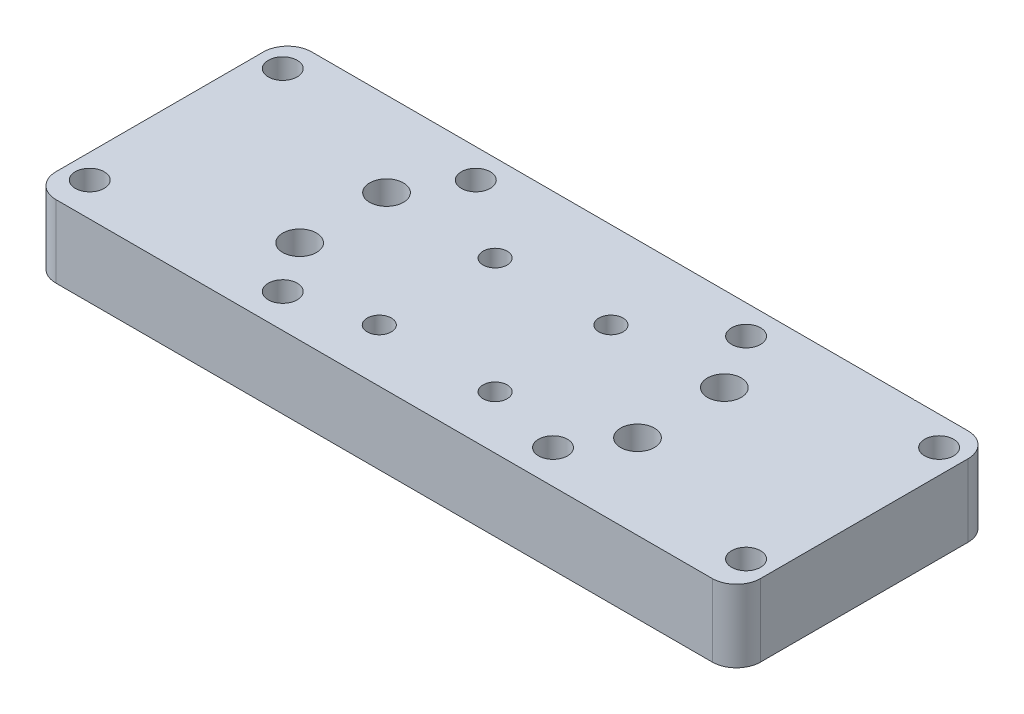
from build123d import *
from build123d.topology import SkipClean

# Parameters (mm, degrees)
SKETCH1_W            = 130
SKETCH1_H            = 100
SKETCH1_R            = 3
BOSS_EXTRUDE1_DEPTH  = 10
SKETCH2_W            = 130
SKETCH2_H            = 8.023003322
BOSS_EXTRUDE2_DEPTH  = 75
FILLET1_R            = 0.1
SKETCH3_W            = 130
SKETCH3_H            = 8.023003322
CUT_EXTRUDE1_DEPTH   = 75
SKETCH4_W            = 130
SKETCH4_H            = 10
CUT_EXTRUDE2_DEPTH   = 37
SKETCH5_W            = 130
SKETCH5_H            = 10
BOSS_EXTRUDE4_DEPTH  = 75
FILLET2_R            = 5
SKETCH6_R            = 10
SKETCH6_R_2          = 7.5
SKETCH6_R_3          = 3.5
SKETCH6_R_4          = 2.5
CUT_EXTRUDE3_DEPTH   = 10
SKETCH7_R            = 19.1
CUT_EXTRUDE4_DEPTH   = 10
SKETCH8_R            = 3.5
BOSS_EXTRUDE5_DEPTH  = 10
SKETCH9_W            = 130
SKETCH9_H            = 10
CUT_EXTRUDE5_DEPTH   = 168.612648687
SKETCH10_W           = 53
SKETCH10_H           = 10
BOSS_EXTRUDE6_DEPTH  = 30
SKETCH11_R           = 3
CUT_EXTRUDE6_DEPTH   = 30
BOSS_EXTRUDE7_START  = -10
SKETCH12_R           = 3
BOSS_EXTRUDE7_DEPTH  = 10
SKETCH14_W           = 53
SKETCH14_H           = 10
CUT_EXTRUDE7_DEPTH   = 14
SKETCH15_W           = 53
SKETCH15_H           = 10
CUT_EXTRUDE9_DEPTH   = 1.5
SKETCH16_W           = 53
SKETCH16_H           = 10
BOSS_EXTRUDE8_DEPTH  = 1.5
FILLET5_R            = 5
SKETCH17_R           = 2.5
CUT_EXTRUDE11_DEPTH  = 10
CUT_EXTRUDE12_DEPTH  = 10
BOSS_EXTRUDE9_DEPTH  = 10
SKETCH20_R           = 3.5
CUT_EXTRUDE13_DEPTH  = 160.32670837
BOSS_EXTRUDE10_START = 5
SKETCH21_R           = 3
SKETCH21_R_2         = 2.5
SKETCH21_R_3         = 3.5
BOSS_EXTRUDE10_DEPTH = 5


with BuildPart() as part:
    # Sketch1 → Boss-Extrude1 (new body)
    with BuildSketch(Plane(origin=(0, 0, 0), x_dir=(1, 0, 0), z_dir=(0, 1, 0))):
        with Locations((65, 13)):
            Rectangle(SKETCH1_W, SKETCH1_H)
        with Locations((5, 17)):
            Circle(SKETCH1_R, mode=Mode.SUBTRACT)
        with Locations((45, 17)):
            Circle(SKETCH1_R, mode=Mode.SUBTRACT)
        with Locations((5, 57)):
            Circle(SKETCH1_R, mode=Mode.SUBTRACT)
        with Locations((45, 57)):
            Circle(SKETCH1_R, mode=Mode.SUBTRACT)
        with Locations((85, 17)):
            Circle(SKETCH1_R, mode=Mode.SUBTRACT)
        with Locations((125, 17)):
            Circle(SKETCH1_R, mode=Mode.SUBTRACT)
        with Locations((85, 57)):
            Circle(SKETCH1_R, mode=Mode.SUBTRACT)
        with Locations((125, 57)):
            Circle(SKETCH1_R, mode=Mode.SUBTRACT)
    extrude(amount=BOSS_EXTRUDE1_DEPTH)

    # Sketch2 → Boss-Extrude2 (add)
    with BuildSketch(Plane(origin=(0, 10, 0), x_dir=(1, 0, 0), z_dir=(0, 1, 0))):
        with Locations((65, -32.988498339)):
            Rectangle(SKETCH2_W, SKETCH2_H)
    extrude(amount=BOSS_EXTRUDE2_DEPTH)

    # Fillet1
    fillet1_edges = [part.edges().sort_by_distance(p)[0] for p in [
        (0, 85, 32.988498339),
        (130, 85, 32.988498339),
        (130, 5, -63),
        (0, 5, -63),
    ]]
    fillet(fillet1_edges, radius=FILLET1_R)

    # Sketch3 → Cut-Extrude1 (cut)
    with BuildSketch(Plane(origin=(0, 85, 0), x_dir=(1, 0, 0), z_dir=(0, 1, 0))):
        with Locations((65, -32.988498339)):
            Rectangle(SKETCH3_W, SKETCH3_H)
    extrude(amount=-CUT_EXTRUDE1_DEPTH, mode=Mode.SUBTRACT)

    # Sketch4 → Cut-Extrude2 (cut)
    with BuildSketch(Plane.XY.offset(37)):
        with Locations((65, 5)):
            Rectangle(SKETCH4_W, SKETCH4_H)
    extrude(amount=-CUT_EXTRUDE2_DEPTH, mode=Mode.SUBTRACT)

    # Sketch5 → Boss-Extrude4 (add)
    with BuildSketch(Plane(origin=(0, 10, 0), x_dir=(1, 0, 0), z_dir=(0, 1, 0))):
        with Locations((65, 5)):
            Rectangle(SKETCH5_W, SKETCH5_H)
    extrude(amount=BOSS_EXTRUDE4_DEPTH)

    # Fillet2
    fillet2_edges = [part.edges().sort_by_distance(p)[0] for p in [
        (130, 85, -5),
        (0, 85, -5),
    ]]
    fillet(fillet2_edges, radius=FILLET2_R)

    # Sketch6 → Cut-Extrude3 (cut)
    with BuildSketch(Plane(origin=(0, 0, -10), x_dir=(-1, 0, 0), z_dir=(0, 0, -1))):
        with Locations((-113, 47.5)):
            Circle(SKETCH6_R)
        with Locations((-65, 47.5)):
            Circle(SKETCH6_R_2)
        with Locations((-17, 47.5)):
            Circle(SKETCH6_R)
        with Locations((-113, 71.5)):
            Circle(SKETCH6_R_3)
        with Locations((-65, 74.04)):
            Circle(SKETCH6_R_3)
        with Locations((-17, 71.5)):
            Circle(SKETCH6_R_3)
        with Locations((-17, 23.5)):
            Circle(SKETCH6_R_3)
        with Locations((-65, 21)):
            Circle(SKETCH6_R_3)
        with Locations((-113, 23.5)):
            Circle(SKETCH6_R_3)
        with Locations((-88.58, 71.06)):
            Circle(SKETCH6_R_4)
        with Locations((-41.44, 71.06)):
            Circle(SKETCH6_R_4)
        with Locations((-41.44, 23.92)):
            Circle(SKETCH6_R_4)
        with Locations((-88.58, 23.92)):
            Circle(SKETCH6_R_4)
    extrude(amount=-CUT_EXTRUDE3_DEPTH, mode=Mode.SUBTRACT)

    # Sketch7 → Cut-Extrude4 (cut)
    with BuildSketch(Plane(origin=(0, 0, -10), x_dir=(-1, 0, 0), z_dir=(0, 0, -1))):
        with Locations((-65, 47.5)):
            Circle(SKETCH7_R)
    extrude(amount=-CUT_EXTRUDE4_DEPTH, mode=Mode.SUBTRACT)

    # Sketch8 → Boss-Extrude5 (add)
    with BuildSketch(Plane(origin=(0, 0, -10), x_dir=(-1, 0, 0), z_dir=(0, 0, -1))):
        with Locations((-65, 74.04)):
            Circle(SKETCH8_R)
        with Locations((-65, 21)):
            Circle(SKETCH8_R)
    extrude(amount=-BOSS_EXTRUDE5_DEPTH)

    # Sketch9 → Cut-Extrude5 (cut, through all)
    with BuildSketch(Plane(origin=(0, 85, 0), x_dir=(1, 0, 0), z_dir=(0, 1, 0))):
        with Locations((65, 5)):
            Rectangle(SKETCH9_W, SKETCH9_H)
    extrude(amount=-CUT_EXTRUDE5_DEPTH, mode=Mode.SUBTRACT)

    # Sketch10 → Boss-Extrude6 (add)
    with BuildSketch(Plane(origin=(130, 0, 0), x_dir=(0, 0, -1), z_dir=(1, 0, 0))):
        with Locations((36.5, 5)):
            Rectangle(SKETCH10_W, SKETCH10_H)
    extrude(amount=BOSS_EXTRUDE6_DEPTH)

    # Sketch11 → Cut-Extrude6 (cut)
    with BuildSketch(Plane(origin=(0, 10, 0), x_dir=(1, 0, 0), z_dir=(0, 1, 0))):
        with Locations((101, 57)):
            Circle(SKETCH11_R)
        with Locations((141, 57)):
            Circle(SKETCH11_R)
        with Locations((141, 17)):
            Circle(SKETCH11_R)
        with Locations((101, 17)):
            Circle(SKETCH11_R)
    extrude(amount=-CUT_EXTRUDE6_DEPTH, mode=Mode.SUBTRACT)

    # Sketch12 → Boss-Extrude7 (add)
    with BuildSketch(Plane(origin=(0, 10, 0), x_dir=(1, 0, 0), z_dir=(0, 1, 0)).offset(BOSS_EXTRUDE7_START)):
        with Locations((85, 57)):
            Circle(SKETCH12_R)
        with Locations((125, 57)):
            Circle(SKETCH12_R)
        with Locations((85, 17)):
            Circle(SKETCH12_R)
        with Locations((125, 17)):
            Circle(SKETCH12_R)
    extrude(amount=BOSS_EXTRUDE7_DEPTH)

    # Sketch14 → Cut-Extrude7 (cut)
    with BuildSketch(Plane(origin=(160, 0, 0), x_dir=(0, 0, -1), z_dir=(1, 0, 0))):
        with Locations((36.5, 5)):
            Rectangle(SKETCH14_W, SKETCH14_H)
    extrude(amount=-CUT_EXTRUDE7_DEPTH, mode=Mode.SUBTRACT)

    # Sketch15 → Cut-Extrude9 (cut)
    with BuildSketch(Plane.ZY):
        with Locations((-36.5, 5)):
            Rectangle(SKETCH15_W, SKETCH15_H)
    extrude(amount=-CUT_EXTRUDE9_DEPTH, mode=Mode.SUBTRACT)

    # Sketch16 → Boss-Extrude8 (add)
    with BuildSketch(Plane.ZY.offset(-1.5)):
        with Locations((-36.5, 5)):
            Rectangle(SKETCH16_W, SKETCH16_H)
    extrude(amount=BOSS_EXTRUDE8_DEPTH)

    # Fillet5
    fillet5_edges = [part.edges().sort_by_distance(p)[0] for p in [
        (146, 5, -63),
        (146, 5, -10),
        (0, 5, -10),
        (0, 5, -63),
    ]]
    fillet(fillet5_edges, radius=FILLET5_R)

    # Sketch17 → Cut-Extrude11 (cut)
    with BuildSketch(Plane(origin=(0, 10, 0), x_dir=(1, 0, 0), z_dir=(0, 1, 0))):
        with Locations((61, 48.5)):
            Circle(SKETCH17_R)
        with Locations((85, 48.5)):
            Circle(SKETCH17_R)
        with Locations((61, 24.5)):
            Circle(SKETCH17_R)
        with Locations((85, 24.5)):
            Circle(SKETCH17_R)
    extrude(amount=-CUT_EXTRUDE11_DEPTH, mode=Mode.SUBTRACT)

    # Sketch18 → Cut-Extrude12 (cut)
    with BuildSketch(Plane(origin=(0, 10, 0), x_dir=(1, 0, 0), z_dir=(0, 1, 0))):
        with BuildLine():
            ThreePointArc((62.785357107, 22.75), (61.968245837, 22.195113886), (61, 22))
            ThreePointArc((61, 22), (60.031754163, 22.195113886), (59.214642893, 22.75))
            ThreePointArc((59.214642893, 22.75), (61, 18.5), (62.785357107, 22.75))
        make_face()
        with BuildLine():
            ThreePointArc((62.785357107, 46.75), (61.968245837, 46.195113886), (61, 46))
            ThreePointArc((61, 46), (60.031754163, 46.195113886), (59.214642893, 46.75))
            ThreePointArc((59.214642893, 46.75), (61, 42.5), (62.785357107, 46.75))
        make_face()
        with BuildLine():
            ThreePointArc((86.785357107, 46.75), (85.968245837, 46.195113886), (85, 46))
            ThreePointArc((85, 46), (84.031754163, 46.195113886), (83.214642893, 46.75))
            ThreePointArc((83.214642893, 46.75), (85, 42.5), (86.785357107, 46.75))
        make_face()
        with BuildLine():
            ThreePointArc((83.214642893, 22.75), (85, 18.5), (86.785357107, 22.75))
            ThreePointArc((86.785357107, 22.75), (85, 22), (83.214642893, 22.75))
        make_face()
    extrude(amount=-CUT_EXTRUDE12_DEPTH, mode=Mode.SUBTRACT)

    # Sketch19 → Boss-Extrude9 (add)
    with SkipClean():  # the faces are left unmerged after this step: merging them gives an invalid solid
        with BuildSketch(Plane(origin=(0, 10, 0), x_dir=(1, 0, 0), z_dir=(0, 1, 0))):
            with BuildLine():
                ThreePointArc((62.785357107, 46.75), (61, 51), (59.214642893, 46.75))
                ThreePointArc((59.214642893, 46.75), (61, 47.5), (62.785357107, 46.75))
            make_face()
            with BuildLine():
                ThreePointArc((86.785357107, 46.75), (85, 51), (83.214642893, 46.75))
                ThreePointArc((83.214642893, 46.75), (85, 47.5), (86.785357107, 46.75))
            make_face()
            with BuildLine():
                ThreePointArc((86.785357107, 22.75), (85, 27), (83.214642893, 22.75))
                ThreePointArc((83.214642893, 22.75), (85, 23.5), (86.785357107, 22.75))
            make_face()
            with BuildLine():
                ThreePointArc((59.214642893, 22.75), (61, 23.5), (62.785357107, 22.75))
                ThreePointArc((62.785357107, 22.75), (61, 27), (59.214642893, 22.75))
            make_face()
        extrude(amount=-BOSS_EXTRUDE9_DEPTH)

    # Sketch20 → Cut-Extrude13 (cut, through all)
    with SkipClean():  # the faces are left unmerged after this step: merging them gives an invalid solid
        with BuildSketch(Plane(origin=(0, 10, 0), x_dir=(1, 0, 0), z_dir=(0, 1, 0))):
            with Locations((38, 45.5)):
                Circle(SKETCH20_R)
            with Locations((38, 27.5)):
                Circle(SKETCH20_R)
            with Locations((108, 45.5)):
                Circle(SKETCH20_R)
            with Locations((108, 27.5)):
                Circle(SKETCH20_R)
        extrude(amount=-CUT_EXTRUDE13_DEPTH, mode=Mode.SUBTRACT)

    # Sketch21 → Boss-Extrude10 (add)
    with BuildSketch(Plane(origin=(0, 10, 0), x_dir=(1, 0, 0), z_dir=(0, 1, 0)).offset(BOSS_EXTRUDE10_START)):
        with BuildLine():
            Line((129.9, 63), (5, 63))
            ThreePointArc((5, 63), (1.464466094, 61.535533906), (0, 58))
            Line((0, 58), (0, 15))
            ThreePointArc((0, 15), (1.464466094, 11.464466094), (5, 10))
            Line((5, 10), (141, 10))
            ThreePointArc((141, 10), (144.535533906, 11.464466094), (146, 15))
            Line((146, 15), (146, 58))
            ThreePointArc((146, 58), (144.535533906, 61.535533906), (141, 63))
            Line((141, 63), (130, 63))
            Line((130, 63), (130, 62.9))
            ThreePointArc((130, 62.9), (129.970710678, 62.970710678), (129.9, 63))
        make_face()
        with Locations((45, 17)):
            Circle(SKETCH21_R, mode=Mode.SUBTRACT)
        with Locations((61, 21)):
            Circle(SKETCH21_R_2, mode=Mode.SUBTRACT)
        with Locations((38, 27.5)):
            Circle(SKETCH21_R_3, mode=Mode.SUBTRACT)
        with Locations((85, 21)):
            Circle(SKETCH21_R_2, mode=Mode.SUBTRACT)
        with Locations((101, 17)):
            Circle(SKETCH21_R, mode=Mode.SUBTRACT)
        with Locations((108, 27.5)):
            Circle(SKETCH21_R_3, mode=Mode.SUBTRACT)
        with Locations((38, 45.5)):
            Circle(SKETCH21_R_3, mode=Mode.SUBTRACT)
        with Locations((61, 45)):
            Circle(SKETCH21_R_2, mode=Mode.SUBTRACT)
        with Locations((45, 57)):
            Circle(SKETCH21_R, mode=Mode.SUBTRACT)
        with Locations((85, 45)):
            Circle(SKETCH21_R_2, mode=Mode.SUBTRACT)
        with Locations((108, 45.5)):
            Circle(SKETCH21_R_3, mode=Mode.SUBTRACT)
        with Locations((101, 57)):
            Circle(SKETCH21_R, mode=Mode.SUBTRACT)
        with Locations((141, 57)):
            Circle(SKETCH21_R, mode=Mode.SUBTRACT)
        with Locations((141, 17)):
            Circle(SKETCH21_R, mode=Mode.SUBTRACT)
        with Locations((5, 17)):
            Circle(SKETCH21_R, mode=Mode.SUBTRACT)
        with Locations((5, 57)):
            Circle(SKETCH21_R, mode=Mode.SUBTRACT)
    extrude(amount=-BOSS_EXTRUDE10_DEPTH)


solid = part.part
